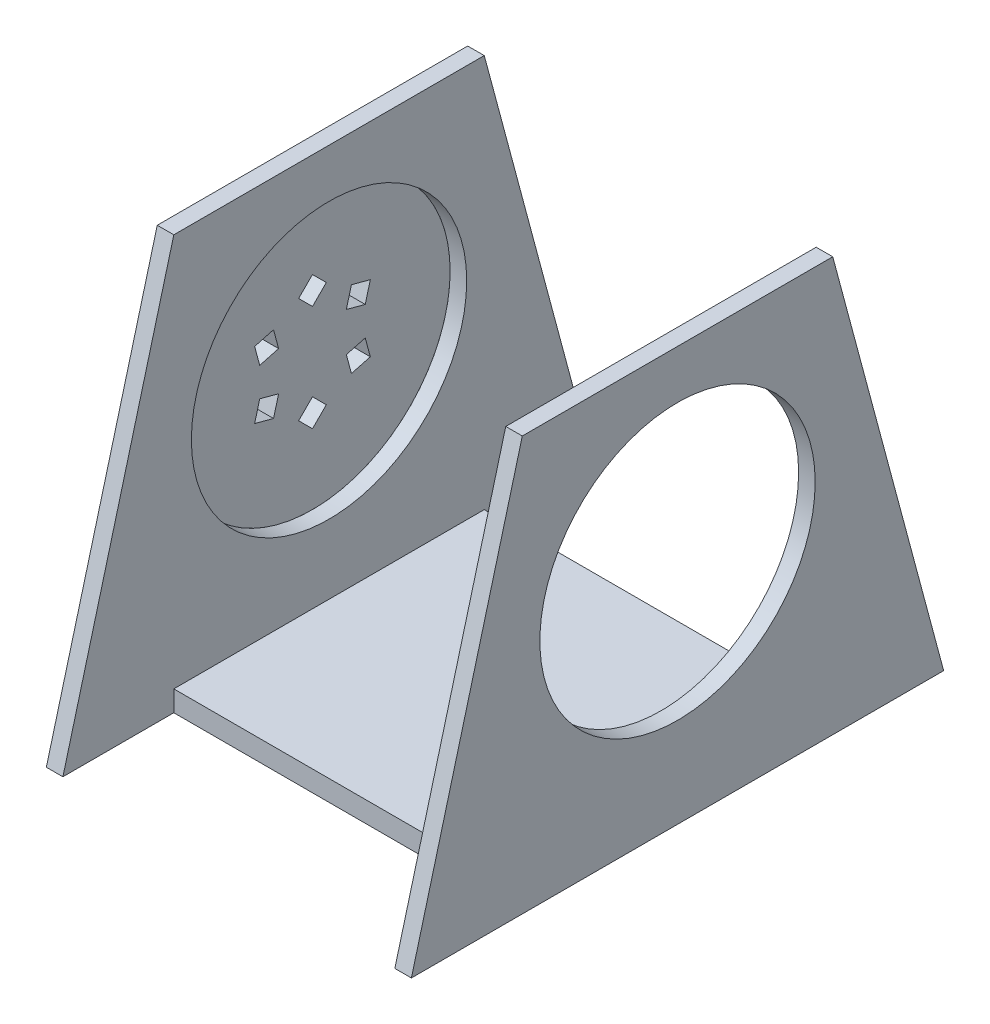
from build123d import *

# Parameters (mm, degrees)
SKETCH1_W           = 56
SKETCH1_H           = 47.625
BOSS_EXTRUDE1_DEPTH = 3.175
SKETCH3_W           = 2.54
SKETCH3_H           = 47.625
BOSS_EXTRUDE3_DEPTH = 60.325
SKETCH4_R           = 21.118322
CUT_EXTRUDE1_DEPTH  = 88.950469904
BOSS_EXTRUDE6_DEPTH = 2.54
BOSS_EXTRUDE7_DEPTH = 2.54
CUT_EXTRUDE4_DEPTH  = 10
SKETCH15_3_R        = 3.5
CUT_EXTRUDE5_DEPTH  = 3


with BuildPart() as part:
    # Sketch1 → Boss-Extrude1 (new body)
    with BuildSketch(Plane(origin=(0, 0, 0), x_dir=(1, 0, 0), z_dir=(0, 1, 0))):
        Rectangle(SKETCH1_W, SKETCH1_H)
    extrude(amount=BOSS_EXTRUDE1_DEPTH)

    # Sketch3 → Boss-Extrude3 (add)
    with BuildSketch(Plane(origin=(0, 3.175, 0), x_dir=(1, 0, 0), z_dir=(0, 1, 0))):
        with Locations((-26.73, 0)):
            Rectangle(SKETCH3_W, SKETCH3_H)
        with Locations((26.73, 0)):
            Rectangle(SKETCH3_W, SKETCH3_H)
    extrude(amount=BOSS_EXTRUDE3_DEPTH)

    # Sketch4 → Cut-Extrude1 (cut, through all)
    with BuildSketch(Plane(origin=(28, 0, 0), x_dir=(0, 0, -1), z_dir=(1, 0, 0))):
        with Locations((0, 34.925)):
            Circle(SKETCH4_R)
    extrude(amount=-CUT_EXTRUDE1_DEPTH, mode=Mode.SUBTRACT)

    # Sketch8 → Boss-Extrude6 (add)
    with BuildSketch(Plane(origin=(-25.46, 0, 0), x_dir=(0, 0, -1), z_dir=(1, 0, 0))):
        Polygon((23.8125, 63.5), (23.8125, 3.175), (23.8125, 0), (40.827273719, 0), align=None)
        Polygon((-23.8125, 63.5), (-40.827273719, 0), (-23.8125, 0), (-23.8125, 3.175), align=None)
    extrude(amount=-BOSS_EXTRUDE6_DEPTH)

    # Sketch9 → Boss-Extrude7 (add)
    with BuildSketch(Plane(origin=(28, 0, 0), x_dir=(0, 0, -1), z_dir=(1, 0, 0))):
        Polygon((23.8125, 0), (40.827273719, 0), (23.8125, 63.5), align=None)
        Polygon((-23.8125, 63.5), (-40.827273719, 0), (-23.8125, 0), align=None)
    extrude(amount=-BOSS_EXTRUDE7_DEPTH)


with BuildPart() as body_2:
    # Loft1: read off the stored shape, not the designer's step
    # Loft1: loft between two sections, ruled curve by curve
    loft1_from = [
        Edge.make_bspline([(-28, 56.042504962, 0.185764067), (-28, 56.414033096, -42.049245856), (-28, 14.179023172, -42.42077399), (-28, 13.807495038, -0.185764067), (-28, 13.435966904, 42.049245856), (-28, 55.670976828, 42.42077399), (-28, 56.042504962, 0.185764067)], [0, 0, 0, 0, 0.5, 0.5, 0.5, 1, 1, 1, 1], 3, [1, 0.333333333, 0.333333333, 1, 0.333333333, 0.333333333, 1]),
    ]
    loft1_to = [
        Edge.make_bspline([(-38, 48.497405787, -6.386689373), (-38, 35.72402704, -33.531500947), (-38, 8.579215466, -20.758122201), (-38, 21.352594213, 6.386689373), (-38, 34.12597296, 33.531500947), (-38, 61.270784534, 20.758122201), (-38, 48.497405787, -6.386689373)], [0, 0, 0, 0, 0.5, 0.5, 0.5, 1, 1, 1, 1], 3, [1, 0.333333333, 0.333333333, 1, 0.333333333, 0.333333333, 1]),
    ]
    loft1 = Solid(Shell([*[Face.make_surface_from_curves(loft1_from[k], loft1_to[k]) for k in range(1)], Face(Wire(loft1_from)), Face(Wire(loft1_to))]))
    add(loft1)

    # Chamfer1: read off the stored shape, not the designer's step
    # Chamfer1 outline → Chamfer1 (revolve, cut)
    with BuildSketch(Plane(origin=(0, 34.925, 0), x_dir=(0, 1, 0), z_dir=(0, 0, -1))):
        Polygon((15.897867596, -36.027042539), (13.377813263, -38), (15.897867596, -38), align=None)
    revolve(axis=Axis((0, 34.925, 0), (1, 0, 0)), mode=Mode.SUBTRACT)

    # Sketch15 → Cut-Extrude4 (cut)
    with BuildSketch(Plane.ZY.offset(38)):
        Polygon((-2.121320344, 42.925), (0, 40.803679656), (2.121320344, 42.925), (0, 45.046320344), align=None)
        Polygon((-5.972609558, 40.701457135), (-8.870387037, 39.925), (-8.093929902, 37.027222521), (-5.196152423, 37.803679656), align=None)
        Polygon((-8.093929902, 32.580136792), (-8.870387037, 29.682359313), (-5.972609558, 28.905902178), (-5.196152423, 31.803679656), align=None)
        Polygon((0, 28.803679656), (-2.121320344, 26.682359313), (0, 24.561038969), (2.121320344, 26.682359313), align=None)
        Polygon((8.870387037, 29.682359313), (8.093929902, 32.580136792), (5.196152423, 31.803679656), (5.972609558, 28.905902178), align=None)
        Polygon((8.093929902, 37.027222521), (8.870387037, 39.925), (5.972609558, 40.701457135), (5.196152423, 37.803679656), align=None)
    extrude(amount=-CUT_EXTRUDE4_DEPTH, mode=Mode.SUBTRACT)

    # Sketch15<3> → Cut-Extrude5 (cut)
    # profile 1 of 6: a face of its own
    with BuildSketch(Plane.ZY.offset(38)):
        with Locations((0, 42.925)):
            Circle(SKETCH15_3_R)
        Polygon((0, 45.046320344), (2.121320344, 42.925), (0, 40.803679656), (-2.121320344, 42.925), align=None, mode=Mode.SUBTRACT)
    # profile 2 of 6: a face of its own
    with BuildSketch(Plane.ZY.offset(38)):
        with Locations((7.03326973, 38.864339828)):
            Circle(SKETCH15_3_R)
        Polygon((5.972609558, 40.701457135), (8.870387037, 39.925), (8.093929902, 37.027222521), (5.196152423, 37.803679656), align=None, mode=Mode.SUBTRACT)
    # profile 3 of 6: a face of its own
    with BuildSketch(Plane.ZY.offset(38)):
        with Locations((7.03326973, 30.743019485)):
            Circle(SKETCH15_3_R)
        Polygon((8.093929902, 32.580136792), (8.870387037, 29.682359313), (5.972609558, 28.905902178), (5.196152423, 31.803679656), align=None, mode=Mode.SUBTRACT)
    # profile 4 of 6: a face of its own
    with BuildSketch(Plane.ZY.offset(38)):
        with Locations((0, 26.682359313)):
            Circle(SKETCH15_3_R)
        Polygon((2.121320344, 26.682359313), (0, 24.561038969), (-2.121320344, 26.682359313), (0, 28.803679656), align=None, mode=Mode.SUBTRACT)
    # profile 5 of 6: a face of its own
    with BuildSketch(Plane.ZY.offset(38)):
        with Locations((-7.03326973, 30.743019485)):
            Circle(SKETCH15_3_R)
        Polygon((-5.972609558, 28.905902178), (-8.870387037, 29.682359313), (-8.093929902, 32.580136792), (-5.196152423, 31.803679656), align=None, mode=Mode.SUBTRACT)
    # profile 6 of 6: a face of its own
    with BuildSketch(Plane.ZY.offset(38)):
        with Locations((-7.03326973, 38.864339828)):
            Circle(SKETCH15_3_R)
        Polygon((-8.093929902, 37.027222521), (-8.870387037, 39.925), (-5.972609558, 40.701457135), (-5.196152423, 37.803679656), align=None, mode=Mode.SUBTRACT)
    extrude(amount=-CUT_EXTRUDE5_DEPTH, mode=Mode.SUBTRACT)


solid = Compound([part.part, body_2.part])
